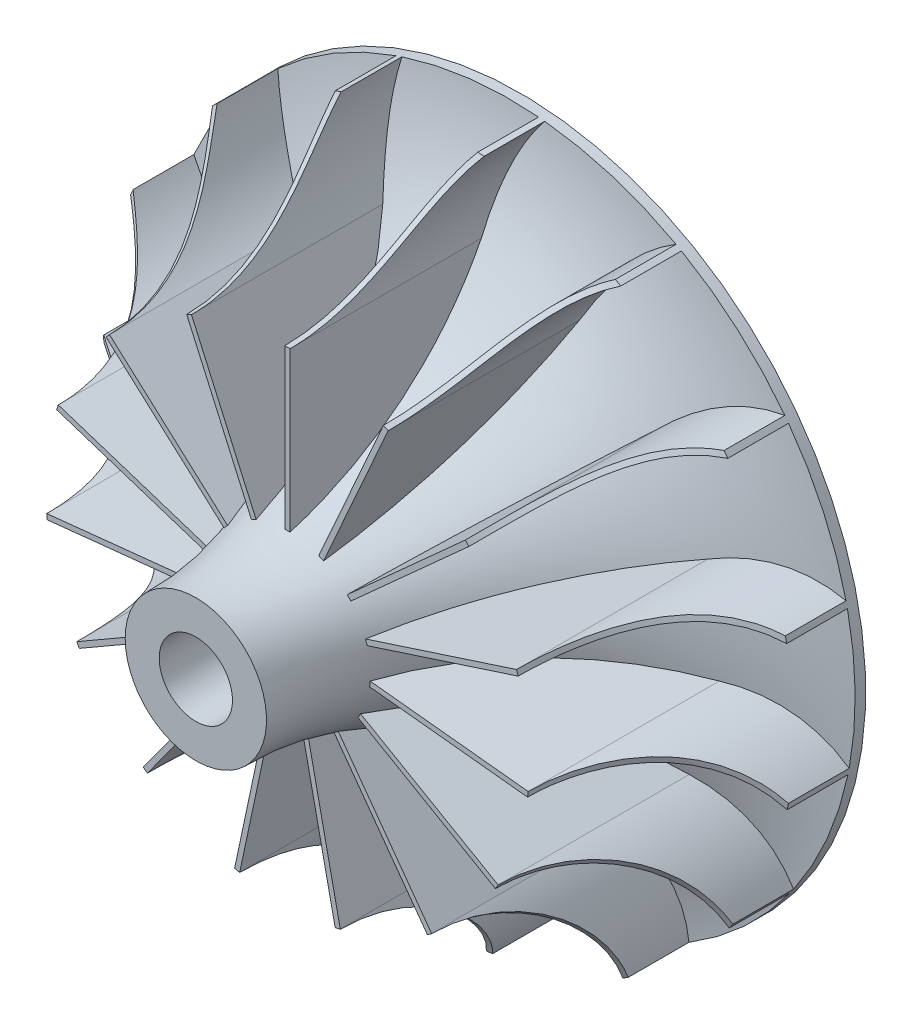
from build123d import *
from build123d.topology import SkipClean

# Parameters (mm, degrees)
SKETCH2_W          = 0.5
SKETCH2_H          = 21.25
CIRPATTERN5_COUNT  = 15
SKETCH4_R          = 17
SKETCH6_R          = 3.5
CUT_EXTRUDE6_DEPTH = 50
SKETCH14_R         = 45.340395489
SKETCH14_R_2       = 33
CUT_EXTRUDE7_DEPTH = 50


with BuildPart() as part:
    # Sketch1 → Revolve1 (revolve)
    with BuildSketch(Plane(origin=(0, 0, 0), x_dir=(1, 0, 0), z_dir=(0, 1, 0))):
        with BuildLine():
            Line((0, 31), (-33, 31))
            Line((-33, 31), (-33, 30))
            ThreePointArc((-33, 30), (-14.103114802, 20.050399548), (-6.75, 0))
            Line((-6.75, 0), (0, 0))
            Line((0, 0), (0, 31))
        make_face()
    revolve(axis=Axis((0, 0, -31), (0, 0, 1)))

    # Sweep1: sweep along a path in Sketch3
    with BuildLine(Plane.XY) as sweep1_path:
        Line((0, 0), (0, 23.1))
        ThreePointArc((0, 23.1), (2.944247938, 32.736501638), (11.424846327, 38.178028144))
    # Sketch2 → Sweep1 (sweep)
    with BuildSketch(Plane(origin=(0, 0, 0), x_dir=(1, 0, 0), z_dir=(0, 1, 0))):
        with Locations((0, 19.375)):
            Rectangle(SKETCH2_W, SKETCH2_H)
    sweep1 = sweep(path=sweep1_path.line, transition=Transition.RIGHT)

    # CirPattern5: Sweep1 ×15 about axis
    cirpattern5_axis = Axis((0, 0, -30), (0, 0, -1))
    for i in range(1, CIRPATTERN5_COUNT):
        add(sweep1.rotate(cirpattern5_axis, i * 360 / CIRPATTERN5_COUNT))

    # Cut-Sweep1: sweep along a path in Sketch5
    with BuildLine(Plane.XY) as cut_sweep1_path:
        CenterArc((0, 0), 40.1, 0, 360)
    # Sketch4 → Cut-Sweep1 (sweep, cut)
    with BuildSketch(Plane(origin=(0, 0, 0), x_dir=(1, 0, 0), z_dir=(0, 1, 0))):
        with Locations((40.1, 8.75)):
            Circle(SKETCH4_R)
    sweep(path=cut_sweep1_path.line, mode=Mode.SUBTRACT)

    # Sketch6 → Cut-Extrude6 (cut)
    with BuildSketch(Plane.XY):
        Circle(SKETCH6_R)
    extrude(amount=-CUT_EXTRUDE6_DEPTH, mode=Mode.SUBTRACT)

    # Sketch14 → Cut-Extrude7 (cut)
    with SkipClean():  # the faces are left unmerged after this step: merging them gives an invalid solid
        with BuildSketch(Plane.XY):
            Circle(SKETCH14_R)
            Circle(SKETCH14_R_2, mode=Mode.SUBTRACT)
        extrude(amount=-CUT_EXTRUDE7_DEPTH, mode=Mode.SUBTRACT)
    add(part.part.scale(1), mode=Mode.REPLACE)  # the faces are merged on a copy


solid = part.part
